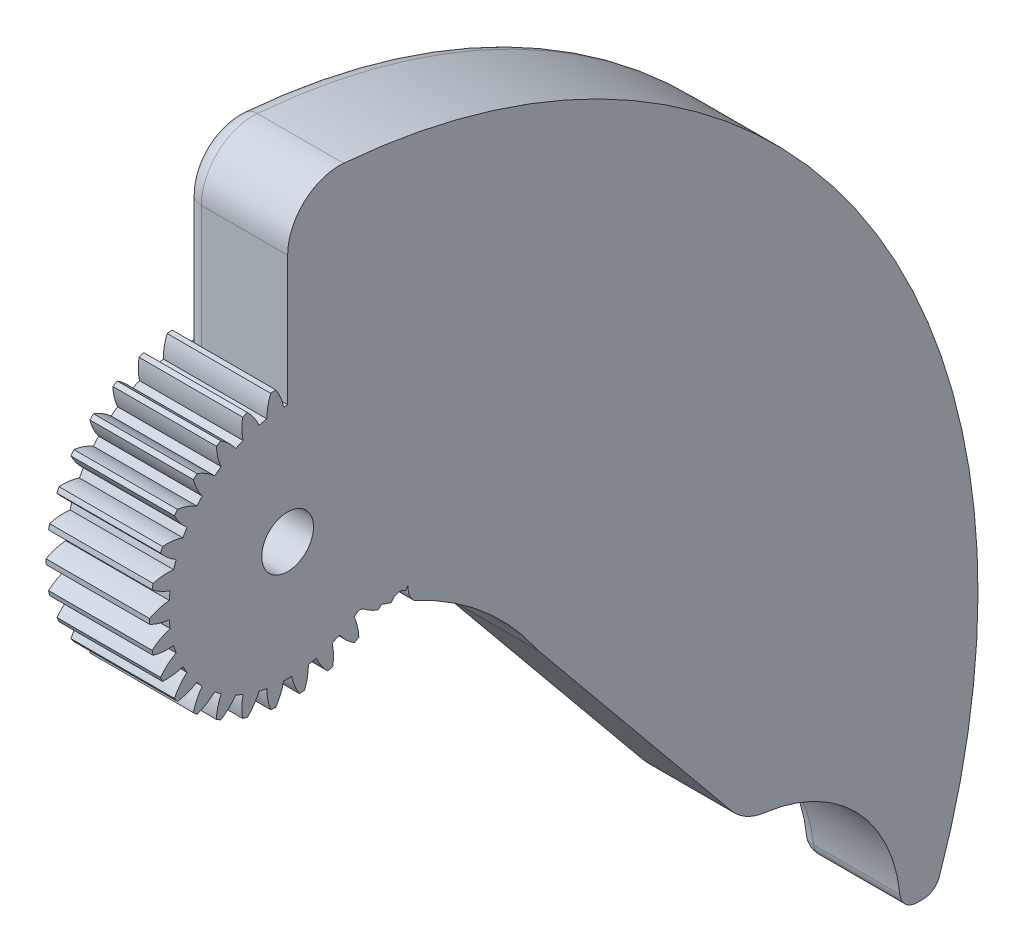
from build123d import *

# Parameters (mm, degrees)
SPUR_GEAR_GB_BORE_OUTLINE_R = 1
SPUR_GEAR_GB_BORE_DEPTH     = 6
EXTRUDE_START               = -6
SKETCH_3_R                  = 1
EXTRUDE_1_DEPTH             = 6
FILLET_2_R                  = 1
FILLET_4_R                  = 3
EXTRUDE_2_DEPTH             = 1
EXTRUDE_2_DEPTH_BACK        = 7
SKETCH_4_R                  = 1.5
FILLET_12_R                 = 3
FILLET_13_R                 = 3
CUT_EXTRUDE_4_DEPTH         = 2
FILLET_15_R                 = 1
CUT_EXTRUDE_5_DEPTH         = 57.089597141
CUT_EXTRUDE_5_DEPTH_BACK    = 57.089597141
SKETCH_9_W                  = 8
SKETCH_9_H                  = 20.416318458
SKETCH_9_H_2                = 38.197882951
CUT_EXTRUDE_7_DEPTH         = 10
CUT_EXTRUDE_7_DEPTH_BACK    = 10
SKETCH_10_R                 = 1.5


# Read off the part's stored shape, not the designer's step: <spur gear_gb>-<Bore>
with BuildPart() as part:
    # <spur gear_gb>-<Bore> outline → <spur gear_gb>-<Bore> (new body)
    with BuildSketch(Plane.YZ):
        with BuildLine():
            ThreePointArc((0.146326846, 7.998661666), (0, 8), (-0.146326846, 7.998661666))
            ThreePointArc((-0.146326846, 7.998661666), (-0.373564224, 7.444765892), (-0.486289788, 6.856777541))
            ThreePointArc((-0.486289788, 6.856777541), (-0.718528657, 6.836343509), (-0.949941023, 6.808045832))
            ThreePointArc((-0.949941023, 6.808045832), (-1.182452915, 7.359748265), (-1.519886018, 7.85429478))
            ThreePointArc((-1.519886018, 7.85429478), (-1.663293526, 7.825180806), (-1.806144524, 7.793448656))
            ThreePointArc((-1.806144524, 7.793448656), (-1.913254814, 7.204411526), (-1.901267401, 6.605835168))
            ThreePointArc((-1.901267401, 6.605835168), (-2.124182819, 6.537562493), (-2.344654853, 6.461769852))
            ThreePointArc((-2.344654853, 6.461769852), (-2.686791187, 6.953074323), (-3.11967257, 7.366657523))
            ThreePointArc((-3.11967257, 7.366657523), (-3.253893145, 7.308363661), (-3.387025021, 7.247624543))
            ThreePointArc((-3.387025021, 7.247624543), (-3.369326988, 6.649189806), (-3.233150506, 6.066186101))
            ThreePointArc((-3.233150506, 6.066186101), (-3.437, 5.953058626), (-3.636896014, 5.833083523))
            ThreePointArc((-3.636896014, 5.833083523), (-4.073703792, 6.242517668), (-4.583114461, 6.557061982))
            ThreePointArc((-4.583114461, 6.557061982), (-4.702282019, 6.472135955), (-4.819876271, 6.385044458))
            ThreePointArc((-4.819876271, 6.385044458), (-4.678143404, 5.803366584), (-4.423729419, 5.261415592))
            ThreePointArc((-4.423729419, 5.261415592), (-4.599603788, 5.10837753), (-4.770187368, 4.949463453))
            ThreePointArc((-4.770187368, 4.949463453), (-5.282575994, 5.259133036), (-5.846252257, 5.460891369))
            ThreePointArc((-5.846252257, 5.460891369), (-5.945158604, 5.353044851), (-6.042075799, 5.243407293))
            ThreePointArc((-6.042075799, 5.243407293), (-5.782502506, 4.703908396), (-5.420970129, 4.226695974))
            ThreePointArc((-5.420970129, 4.226695974), (-5.561182819, 4.040435824), (-5.694998644, 3.84952808))
            ThreePointArc((-5.694998644, 3.84952808), (-6.260574276, 4.045899054), (-6.853880777, 4.126053599))
            ThreePointArc((-6.853880777, 4.126053599), (-6.92820323, 4), (-7.000207622, 3.872608067))
            ThreePointArc((-7.000207622, 3.872608067), (-6.6341385, 3.398866838), (-6.181288432, 3.007249461))
            ThreePointArc((-6.181288432, 3.007249461), (-6.279711476, 2.795907685), (-6.370911152, 2.581349858))
            ThreePointArc((-6.370911152, 2.581349858), (-6.96495542, 2.65583987), (-7.561961817, 2.610887487))
            ThreePointArc((-7.561961817, 2.610887487), (-7.60845213, 2.472135955), (-7.652396782, 2.332557287))
            ThreePointArc((-7.652396782, 2.332557287), (-7.195830808, 1.94527849), (-6.671454769, 1.656371715))
            ThreePointArc((-6.671454769, 1.656371715), (-6.723786607, 1.429184963), (-6.768384272, 1.200354261))
            ThreePointArc((-6.768384272, 1.200354261), (-7.364934592, 1.149707739), (-7.939548841, 0.981613064))
            ThreePointArc((-7.939548841, 0.981613064), (-7.956175163, 0.836227706), (-7.970139481, 0.69056256))
            ThreePointArc((-7.970139481, 0.69056256), (-7.44303078, 0.406672138), (-6.87004652, 0.233102578))
            ThreePointArc((-6.87004652, 0.233102578), (-6.874, 0), (-6.87004652, -0.233102578))
            ThreePointArc((-6.87004652, -0.233102578), (-7.44303078, -0.406672138), (-7.970139481, -0.69056256))
            ThreePointArc((-7.970139481, -0.69056256), (-7.956175163, -0.836227706), (-7.939548841, -0.981613064))
            ThreePointArc((-7.939548841, -0.981613064), (-7.364934592, -1.149707739), (-6.768384272, -1.200354261))
            ThreePointArc((-6.768384272, -1.200354261), (-6.723786607, -1.429184963), (-6.671454769, -1.656371715))
            ThreePointArc((-6.671454769, -1.656371715), (-7.195830808, -1.94527849), (-7.652396782, -2.332557287))
            ThreePointArc((-7.652396782, -2.332557287), (-7.60845213, -2.472135955), (-7.561961817, -2.610887487))
            ThreePointArc((-7.561961817, -2.610887487), (-6.96495542, -2.65583987), (-6.370911152, -2.581349858))
            ThreePointArc((-6.370911152, -2.581349858), (-6.279711476, -2.795907685), (-6.181288432, -3.007249461))
            ThreePointArc((-6.181288432, -3.007249461), (-6.6341385, -3.398866838), (-7.000207622, -3.872608067))
            ThreePointArc((-7.000207622, -3.872608067), (-6.92820323, -4), (-6.853880777, -4.126053599))
            ThreePointArc((-6.853880777, -4.126053599), (-6.260574276, -4.045899054), (-5.694998644, -3.84952808))
            ThreePointArc((-5.694998644, -3.84952808), (-5.561182819, -4.040435824), (-5.420970129, -4.226695974))
            ThreePointArc((-5.420970129, -4.226695974), (-5.782502506, -4.703908396), (-6.042075799, -5.243407293))
            ThreePointArc((-6.042075799, -5.243407293), (-5.945158604, -5.353044851), (-5.846252257, -5.460891369))
            ThreePointArc((-5.846252257, -5.460891369), (-5.282575994, -5.259133036), (-4.770187368, -4.949463453))
            ThreePointArc((-4.770187368, -4.949463453), (-4.599603788, -5.10837753), (-4.423729419, -5.261415592))
            ThreePointArc((-4.423729419, -5.261415592), (-4.678143404, -5.803366584), (-4.819876271, -6.385044458))
            ThreePointArc((-4.819876271, -6.385044458), (-4.702282019, -6.472135955), (-4.583114461, -6.557061982))
            ThreePointArc((-4.583114461, -6.557061982), (-4.073703792, -6.242517668), (-3.636896014, -5.833083523))
            ThreePointArc((-3.636896014, -5.833083523), (-3.437, -5.953058626), (-3.233150506, -6.066186101))
            ThreePointArc((-3.233150506, -6.066186101), (-3.369326988, -6.649189806), (-3.387025021, -7.247624543))
            ThreePointArc((-3.387025021, -7.247624543), (-3.253893145, -7.308363661), (-3.11967257, -7.366657523))
            ThreePointArc((-3.11967257, -7.366657523), (-2.686791187, -6.953074323), (-2.344654853, -6.461769852))
            ThreePointArc((-2.344654853, -6.461769852), (-2.124182819, -6.537562493), (-1.901267401, -6.605835168))
            ThreePointArc((-1.901267401, -6.605835168), (-1.913254814, -7.204411526), (-1.806144524, -7.793448656))
            ThreePointArc((-1.806144524, -7.793448656), (-1.663293526, -7.825180806), (-1.519886018, -7.85429478))
            ThreePointArc((-1.519886018, -7.85429478), (-1.182452915, -7.359748265), (-0.949941023, -6.808045832))
            ThreePointArc((-0.949941023, -6.808045832), (-0.718528657, -6.836343509), (-0.486289788, -6.856777541))
            ThreePointArc((-0.486289788, -6.856777541), (-0.373564224, -7.444765892), (-0.146326846, -7.998661666))
            ThreePointArc((-0.146326846, -7.998661666), (0, -8), (0.146326846, -7.998661666))
            ThreePointArc((0.146326846, -7.998661666), (0.373564224, -7.444765892), (0.486289788, -6.856777541))
            ThreePointArc((0.486289788, -6.856777541), (0.718528657, -6.836343509), (0.949941023, -6.808045832))
            ThreePointArc((0.949941023, -6.808045832), (1.182452915, -7.359748265), (1.519886018, -7.85429478))
            ThreePointArc((1.519886018, -7.85429478), (1.663293526, -7.825180806), (1.806144524, -7.793448656))
            ThreePointArc((1.806144524, -7.793448656), (1.913254814, -7.204411526), (1.901267401, -6.605835168))
            ThreePointArc((1.901267401, -6.605835168), (2.124182819, -6.537562493), (2.344654853, -6.461769852))
            ThreePointArc((2.344654853, -6.461769852), (2.686791187, -6.953074323), (3.11967257, -7.366657523))
            ThreePointArc((3.11967257, -7.366657523), (3.253893145, -7.308363661), (3.387025021, -7.247624543))
            ThreePointArc((3.387025021, -7.247624543), (3.369326988, -6.649189806), (3.233150506, -6.066186101))
            ThreePointArc((3.233150506, -6.066186101), (3.437, -5.953058626), (3.636896014, -5.833083523))
            ThreePointArc((3.636896014, -5.833083523), (4.073703792, -6.242517668), (4.583114461, -6.557061982))
            ThreePointArc((4.583114461, -6.557061982), (4.702282019, -6.472135955), (4.819876271, -6.385044458))
            ThreePointArc((4.819876271, -6.385044458), (4.678143404, -5.803366584), (4.423729419, -5.261415592))
            ThreePointArc((4.423729419, -5.261415592), (4.599603788, -5.10837753), (4.770187368, -4.949463453))
            ThreePointArc((4.770187368, -4.949463453), (5.282575994, -5.259133036), (5.846252257, -5.460891369))
            ThreePointArc((5.846252257, -5.460891369), (5.945158604, -5.353044851), (6.042075799, -5.243407293))
            ThreePointArc((6.042075799, -5.243407293), (5.782502506, -4.703908396), (5.420970129, -4.226695974))
            ThreePointArc((5.420970129, -4.226695974), (5.561182819, -4.040435824), (5.694998644, -3.84952808))
            ThreePointArc((5.694998644, -3.84952808), (6.260574276, -4.045899054), (6.853880777, -4.126053599))
            ThreePointArc((6.853880777, -4.126053599), (6.92820323, -4), (7.000207622, -3.872608067))
            ThreePointArc((7.000207622, -3.872608067), (6.6341385, -3.398866838), (6.181288432, -3.007249461))
            ThreePointArc((6.181288432, -3.007249461), (6.279711476, -2.795907685), (6.370911152, -2.581349858))
            ThreePointArc((6.370911152, -2.581349858), (6.96495542, -2.65583987), (7.561961817, -2.610887487))
            ThreePointArc((7.561961817, -2.610887487), (7.60845213, -2.472135955), (7.652396782, -2.332557287))
            ThreePointArc((7.652396782, -2.332557287), (7.195830808, -1.94527849), (6.671454769, -1.656371715))
            ThreePointArc((6.671454769, -1.656371715), (6.723786607, -1.429184963), (6.768384272, -1.200354261))
            ThreePointArc((6.768384272, -1.200354261), (7.364934592, -1.149707739), (7.939548841, -0.981613064))
            ThreePointArc((7.939548841, -0.981613064), (7.956175163, -0.836227706), (7.970139481, -0.69056256))
            ThreePointArc((7.970139481, -0.69056256), (7.44303078, -0.406672138), (6.87004652, -0.233102578))
            ThreePointArc((6.87004652, -0.233102578), (6.874, 0), (6.87004652, 0.233102578))
            ThreePointArc((6.87004652, 0.233102578), (7.44303078, 0.406672138), (7.970139481, 0.69056256))
            ThreePointArc((7.970139481, 0.69056256), (7.956175163, 0.836227706), (7.939548841, 0.981613064))
            ThreePointArc((7.939548841, 0.981613064), (7.364934592, 1.149707739), (6.768384272, 1.200354261))
            ThreePointArc((6.768384272, 1.200354261), (6.723786607, 1.429184963), (6.671454769, 1.656371715))
            ThreePointArc((6.671454769, 1.656371715), (7.195830808, 1.94527849), (7.652396782, 2.332557287))
            ThreePointArc((7.652396782, 2.332557287), (7.60845213, 2.472135955), (7.561961817, 2.610887487))
            ThreePointArc((7.561961817, 2.610887487), (6.96495542, 2.65583987), (6.370911152, 2.581349858))
            ThreePointArc((6.370911152, 2.581349858), (6.279711476, 2.795907685), (6.181288432, 3.007249461))
            ThreePointArc((6.181288432, 3.007249461), (6.6341385, 3.398866838), (7.000207622, 3.872608067))
            ThreePointArc((7.000207622, 3.872608067), (6.92820323, 4), (6.853880777, 4.126053599))
            ThreePointArc((6.853880777, 4.126053599), (6.260574276, 4.045899054), (5.694998644, 3.84952808))
            ThreePointArc((5.694998644, 3.84952808), (5.561182819, 4.040435824), (5.420970129, 4.226695974))
            ThreePointArc((5.420970129, 4.226695974), (5.782502506, 4.703908396), (6.042075799, 5.243407293))
            ThreePointArc((6.042075799, 5.243407293), (5.945158604, 5.353044851), (5.846252257, 5.460891369))
            ThreePointArc((5.846252257, 5.460891369), (5.282575994, 5.259133036), (4.770187368, 4.949463453))
            ThreePointArc((4.770187368, 4.949463453), (4.599603788, 5.10837753), (4.423729419, 5.261415592))
            ThreePointArc((4.423729419, 5.261415592), (4.678143404, 5.803366584), (4.819876271, 6.385044458))
            ThreePointArc((4.819876271, 6.385044458), (4.702282019, 6.472135955), (4.583114461, 6.557061982))
            ThreePointArc((4.583114461, 6.557061982), (4.073703792, 6.242517668), (3.636896014, 5.833083523))
            ThreePointArc((3.636896014, 5.833083523), (3.437, 5.953058626), (3.233150506, 6.066186101))
            ThreePointArc((3.233150506, 6.066186101), (3.369326988, 6.649189806), (3.387025021, 7.247624543))
            ThreePointArc((3.387025021, 7.247624543), (3.253893145, 7.308363661), (3.11967257, 7.366657523))
            ThreePointArc((3.11967257, 7.366657523), (2.686791187, 6.953074323), (2.344654853, 6.461769852))
            ThreePointArc((2.344654853, 6.461769852), (2.124182819, 6.537562493), (1.901267401, 6.605835168))
            ThreePointArc((1.901267401, 6.605835168), (1.913254814, 7.204411526), (1.806144524, 7.793448656))
            ThreePointArc((1.806144524, 7.793448656), (1.663293526, 7.825180806), (1.519886018, 7.85429478))
            ThreePointArc((1.519886018, 7.85429478), (1.182452915, 7.359748265), (0.949941023, 6.808045832))
            ThreePointArc((0.949941023, 6.808045832), (0.718528657, 6.836343509), (0.486289788, 6.856777541))
            ThreePointArc((0.486289788, 6.856777541), (0.373564224, 7.444765892), (0.146326846, 7.998661666))
        make_face()
        Circle(SPUR_GEAR_GB_BORE_OUTLINE_R, mode=Mode.SUBTRACT)
    extrude(amount=SPUR_GEAR_GB_BORE_DEPTH)

    # 草图3 → 凸台-拉伸1 (add)
    with BuildSketch(Plane(origin=(6, 0, 0), x_dir=(0, 0, -1), z_dir=(1, 0, 0)).offset(EXTRUDE_START)):
        Circle(SKETCH_3_R)
        with BuildLine():
            ThreePointArc((0, 6.874), (0.116568051, 6.873011559), (0.233102578, 6.87004652))
            ThreePointArc((0.233102578, 6.87004652), (0.406672138, 7.44303078), (0.69056256, 7.970139481))
            ThreePointArc((0.69056256, 7.970139481), (0.836227706, 7.956175163), (0.981613064, 7.939548841))
            ThreePointArc((0.981613064, 7.939548841), (1.149707739, 7.364934592), (1.200354261, 6.768384272))
            ThreePointArc((1.200354261, 6.768384272), (1.429184963, 6.723786607), (1.656371715, 6.671454769))
            ThreePointArc((1.656371715, 6.671454769), (1.94527849, 7.195830808), (2.332557287, 7.652396782))
            ThreePointArc((2.332557287, 7.652396782), (2.472135955, 7.60845213), (2.610887487, 7.561961817))
            ThreePointArc((2.610887487, 7.561961817), (2.65583987, 6.96495542), (2.581349858, 6.370911152))
            ThreePointArc((2.581349858, 6.370911152), (2.795907685, 6.279711476), (3.007249461, 6.181288432))
            ThreePointArc((3.007249461, 6.181288432), (3.398866838, 6.6341385), (3.872608067, 7.000207622))
            ThreePointArc((3.872608067, 7.000207622), (4, 6.92820323), (4.126053599, 6.853880777))
            ThreePointArc((4.126053599, 6.853880777), (4.045899054, 6.260574276), (3.84952808, 5.694998644))
            ThreePointArc((3.84952808, 5.694998644), (4.040435824, 5.561182819), (4.226695974, 5.420970129))
            ThreePointArc((4.226695974, 5.420970129), (4.703908396, 5.782502506), (5.243407293, 6.042075799))
            ThreePointArc((5.243407293, 6.042075799), (5.353044851, 5.945158604), (5.460891369, 5.846252257))
            ThreePointArc((5.460891369, 5.846252257), (5.259133036, 5.282575994), (4.949463453, 4.770187368))
            ThreePointArc((4.949463453, 4.770187368), (5.108377531, 4.599603788), (5.261415592, 4.423729419))
            ThreePointArc((5.261415592, 4.423729419), (5.803366584, 4.678143404), (6.385044458, 4.819876271))
            ThreePointArc((6.385044458, 4.819876271), (6.472135955, 4.702282019), (6.557061982, 4.583114461))
            ThreePointArc((6.557061982, 4.583114461), (6.242517668, 4.073703792), (5.833083523, 3.636896014))
            ThreePointArc((5.833083523, 3.636896014), (5.953058626, 3.437), (6.066186101, 3.233150506))
            ThreePointArc((6.066186101, 3.233150506), (6.649189806, 3.369326988), (7.247624543, 3.387025021))
            ThreePointArc((7.247624543, 3.387025021), (7.308363661, 3.253893145), (7.366657523, 3.11967257))
            ThreePointArc((7.366657523, 3.11967257), (6.953074323, 2.686791187), (6.461769852, 2.344654853))
            ThreePointArc((6.461769852, 2.344654853), (6.537562493, 2.12418282), (6.605835168, 1.901267401))
            ThreePointArc((6.605835168, 1.901267401), (7.204411526, 1.913254814), (7.793448656, 1.806144524))
            ThreePointArc((7.793448656, 1.806144524), (7.825180806, 1.663293526), (7.85429478, 1.519886018))
            ThreePointArc((7.85429478, 1.519886018), (7.359748265, 1.182452915), (6.808045832, 0.949941023))
            ThreePointArc((6.808045832, 0.949941023), (6.836343509, 0.718528657), (6.856777541, 0.486289788))
            ThreePointArc((6.856777541, 0.486289788), (7.444765892, 0.373564224), (7.998661666, 0.146326846))
            ThreePointArc((7.998661666, 0.146326846), (8, 0), (7.998661666, -0.146326846))
            ThreePointArc((7.998661666, -0.146326846), (7.444765892, -0.373564224), (6.856777541, -0.486289788))
            ThreePointArc((6.856777541, -0.486289788), (6.836343509, -0.718528657), (6.808045832, -0.949941023))
            ThreePointArc((6.808045832, -0.949941023), (7.359748265, -1.182452915), (7.85429478, -1.519886018))
            ThreePointArc((7.85429478, -1.519886018), (7.825180806, -1.663293526), (7.793448656, -1.806144524))
            ThreePointArc((7.793448656, -1.806144524), (7.204411526, -1.913254814), (6.605835168, -1.901267401))
            ThreePointArc((6.605835168, -1.901267401), (6.537562493, -2.12418282), (6.461769852, -2.344654853))
            ThreePointArc((6.461769852, -2.344654853), (6.953074323, -2.686791187), (7.366657523, -3.11967257))
            ThreePointArc((7.366657523, -3.11967257), (7.308363661, -3.253893145), (7.247624543, -3.387025021))
            ThreePointArc((7.247624543, -3.387025021), (6.649189806, -3.369326988), (6.066186101, -3.233150506))
            ThreePointArc((6.066186101, -3.233150506), (5.953058626, -3.437), (5.833083523, -3.636896014))
            ThreePointArc((5.833083523, -3.636896014), (6.242517668, -4.073703792), (6.557061982, -4.583114461))
            ThreePointArc((6.557061982, -4.583114461), (6.472135955, -4.702282019), (6.385044458, -4.819876271))
            ThreePointArc((6.385044458, -4.819876271), (5.803366584, -4.678143404), (5.261415592, -4.423729419))
            ThreePointArc((5.261415592, -4.423729419), (5.108377531, -4.599603788), (4.949463453, -4.770187368))
            ThreePointArc((4.949463453, -4.770187368), (5.259133036, -5.282575994), (5.460891369, -5.846252257))
            ThreePointArc((5.460891369, -5.846252257), (5.449932317, -5.856469733), (5.438954148, -5.866666667))
            ThreePointArc((5.438954148, -5.866666667), (5.727459414, -5.963790983), (6.014231603, -6.065919003))
            ThreePointArc((6.014231603, -6.065919003), (6.365660186, -5.757994622), (6.818051819, -5.874876117))
            ThreePointArc((6.818051819, -5.874876117), (6.900351293, -5.77798858), (6.981274071, -5.67994827))
            Line((6.981274071, -5.67994827), (6.981274071, -5.845324529))
            ThreePointArc((6.981274071, -5.845324529), (7.05251579, -6.216010455), (7.256090183, -6.533879777))
            Line((7.256090183, -6.533879777), (7.325551695, -6.607036388))
            ThreePointArc((7.325551695, -6.607036388), (11.315016389, -9.150078497), (14.477500555, -12.668826231))
            Line((14.477500555, -12.668826231), (26.521904807, -27.346153846))
            ThreePointArc((26.521904807, -27.346153846), (32.885865838, -29.982192815), (35.521904807, -36.346153846))
            Line((35.521904807, -36.346153846), (37.527110516, -36.346153846))
            ThreePointArc((37.527110516, -36.346153846), (32.816506166, 0.370874996), (0, 17.5))
            Line((0, 17.5), (0, 6.874))
        make_face()
        with BuildLine():
            ThreePointArc((4.226695974, -5.420970129), (4.178848498, -5.457939285), (4.130677684, -5.494486133))
            ThreePointArc((4.130677684, -5.494486133), (4.2582419, -5.525979383), (4.385566063, -5.558429521))
            ThreePointArc((4.385566063, -5.558429521), (4.304927405, -5.491090913), (4.226695974, -5.420970129))
        make_face()
    extrude(amount=EXTRUDE_1_DEPTH)

    # 圆角2
    fillet_2_edges = [part.edges().sort_by_distance(p)[0] for p in [
        (3, -36.346153846, -37.527110516),
        (3, -36.346153846, -35.521904807),
    ]]
    fillet(fillet_2_edges, radius=FILLET_2_R)

    # 圆角4
    fillet_4_edges = [part.edges().sort_by_distance(p)[0] for p in [
        (3, 17.5, 0),
    ]]
    fillet(fillet_4_edges, radius=FILLET_4_R)

    # 草图4 → 凸台-拉伸2 (add, two sides: drawn at the far end of the back side and taken through both)
    with BuildSketch(Plane(origin=(6, 0, 0), x_dir=(0, 0, -1), z_dir=(1, 0, 0)).offset(-EXTRUDE_2_DEPTH_BACK)):
        Circle(SKETCH_4_R)
    extrude(amount=EXTRUDE_2_DEPTH + EXTRUDE_2_DEPTH_BACK)

    # 圆角12
    fillet_12_edges = [part.edges().sort_by_distance(p)[0] for p in [
        (3, -27.346153846, -26.521904807),
    ]]
    fillet(fillet_12_edges, radius=FILLET_12_R)

    # 圆角13
    # the kernel refuses this fillet: 3 mm, written as the material it takes off along each edge
    with BuildSketch(Plane(origin=(-0.326683618, -12.668826231, -14.477500555), x_dir=(0, -0.7730354346519555, -0.6343628431524521), z_dir=(1, 0, 0))) as fillet_13_piece_1:
        with BuildLine():
            CenterArc((0.130673447, 3), FILLET_13_R, 265.201625675, 4.798374325)
            ThreePointArc((-0.120275261, 0.010514301), (-0.060128563, 0.005360874), (0, 0))
            Line((0, 0), (0.130673447, 0))
        make_face()
    extrude(amount=6.653367237, mode=Mode.SUBTRACT)

    # 草图8 → 切除-拉伸4 (cut)
    with BuildSketch(Plane(origin=(6, 0, 0), x_dir=(0, 0, -1), z_dir=(1, 0, 0))):
        with BuildLine():
            Line((2, 9.64604276), (2, 14.378177829))
            ThreePointArc((2, 14.378177829), (2.322165611, 15.113392451), (3.081081081, 15.374885338))
            ThreePointArc((3.081081081, 15.374885338), (30.622404445, 0.000407685), (37.065250477, -30.876586838))
            ThreePointArc((37.065250477, -30.876586838), (36.648392735, -31.261324427), (36.140347856, -31.008967949))
            ThreePointArc((36.140347856, -31.008967949), (32.68375662, -27.233987132), (27.893022457, -25.431941259))
            ThreePointArc((27.893022457, -25.431941259), (27.534481636, -25.315256804), (27.244634082, -25.074102958))
            Line((27.244634082, -25.074102958), (16.106465804, -11.50111575))
            Line((16.106465804, -11.50111575), (16.056110934, -11.434228374))
            ThreePointArc((16.056110934, -11.434228374), (12.755730443, -7.750717276), (8.634797868, -5.01599972))
            ThreePointArc((8.634797868, -5.01599972), (8.381262895, -4.723999257), (8.411826139, -4.338499399))
            ThreePointArc((8.411826139, -4.338499399), (8.640174856, 3.863777232), (2.374557752, 9.162034246))
            ThreePointArc((2.374557752, 9.162034246), (2.104575466, 9.340037143), (2, 9.64604276))
        make_face()
    extrude(amount=-CUT_EXTRUDE_4_DEPTH, mode=Mode.SUBTRACT)

    # 圆角15
    # the kernel refuses this fillet: 1 mm, written as the material it takes off along each edge
    with BuildSketch(Plane(origin=(6, -22.5, 0), x_dir=(0, 0.9585171915228717, -0.28503472341998315), z_dir=(0, 0.28503472341998315, 0.9585171915228717))) as fillet_15_piece_1_section:
        with BuildLine():
            CenterArc((17.5 + FILLET_15_R, FILLET_15_R), FILLET_15_R, 180, 90)
            Line((17.5 + FILLET_15_R, 0), (17.5, 0))
            Line((17.5, 0), (17.5, FILLET_15_R))
        make_face()
    fillet_15_piece_1 = revolve(axis=Axis((6, -22.5, 0), (-1, 0, 0)), revolution_arc=38.864706403, mode=Mode.PRIVATE)
    fillet_15_piece_1 = fillet_15_piece_1 - Plane(origin=(5.717207108, -1.313e-06, -1.172e-06), x_dir=(0, -0.7552594768548913, -0.6554259093298617), z_dir=(-1, 0, 0)) * Cylinder(7.99999824, 75, mode=Mode.PRIVATE)
    add(fillet_15_piece_1, mode=Mode.SUBTRACT)
    with BuildSketch(Plane(origin=(6, 14.378177829, 0), x_dir=(-1, 0, 0), z_dir=(0, -1, 0))) as fillet_15_piece_2_section:
        with BuildLine():
            CenterArc((FILLET_15_R, FILLET_15_R), FILLET_15_R, 180, 90)
            Line((0, FILLET_15_R), (0, 0))
            Line((0, 0), (FILLET_15_R, 0))
        make_face()
    fillet_15_piece_2 = extrude(amount=10.004177829, mode=Mode.PRIVATE)
    fillet_15_piece_2 = fillet_15_piece_2 - Plane(origin=(5.7737618, 1.47e-07, 0), x_dir=(0, 0.9994248646952593, -0.03391076272900277), z_dir=(-1, 0, 0)) * Cylinder(6.873999853, 25, mode=Mode.PRIVATE)
    add(fillet_15_piece_2, mode=Mode.SUBTRACT)
    with BuildSketch(Plane(origin=(6, -36.346153846, -36.471779178), x_dir=(-1, 0, 0), z_dir=(0, 0, -1))) as fillet_15_piece_3:
        with BuildLine():
            CenterArc((FILLET_15_R, FILLET_15_R), FILLET_15_R, 180, 90)
            Line((0, FILLET_15_R), (0, 0))
            Line((0, 0), (FILLET_15_R, 0))
        make_face()
    extrude(amount=0.351804724, mode=Mode.SUBTRACT)
    with BuildSketch(Plane(origin=(6, -36.346153846, -26.521904807), x_dir=(0, 0.9922011442520794, -0.12464705911037026), z_dir=(0, 0.12464705911037026, 0.9922011442520794))) as fillet_15_piece_4:
        with BuildLine():
            CenterArc((9 + FILLET_15_R, FILLET_15_R), FILLET_15_R, 180, 90)
            Line((9 + FILLET_15_R, 0), (9, 0))
            Line((9, 0), (9, FILLET_15_R))
        make_face()
    revolve(axis=Axis((6, -36.346153846, -26.521904807), (-1, 0, 0)), revolution_arc=77.100455169, mode=Mode.SUBTRACT)
    with BuildSketch(Plane(origin=(6, -22.5, 0), x_dir=(0, -0.32938856015777646, -0.9441944590163548), z_dir=(0, -0.9441944590163548, 0.32938856015777646))) as fillet_15_piece_5:
        with BuildLine():
            CenterArc((40 - FILLET_15_R, -FILLET_15_R), FILLET_15_R, 0, 90)
            Line((40 - FILLET_15_R, 0), (40, 0))
            Line((40, 0), (40, -FILLET_15_R))
        make_face()
    revolve(axis=Axis((6, -22.5, 0), (1, 0, 0)), revolution_arc=104.580958789, mode=Mode.SUBTRACT)
    with BuildSketch(Plane(origin=(6, 14.378177829, -3), x_dir=(0, 0.9967075088965284, -0.08108108108108128), z_dir=(0, -0.08108108108108128, -0.9967075088965284))) as fillet_15_piece_6:
        with BuildLine():
            CenterArc((3 - FILLET_15_R, -FILLET_15_R), FILLET_15_R, 0, 90)
            Line((3 - FILLET_15_R, 0), (3, 0))
            Line((3, 0), (3, -FILLET_15_R))
        make_face()
    revolve(axis=Axis((6, 14.378177829, -3), (1, 0, 0)), revolution_arc=94.650709005, mode=Mode.SUBTRACT)
    with BuildSketch(Plane(origin=(6, -12.769841436, -14.560394934), x_dir=(-1, 0, 0), z_dir=(0, -0.7730354346519522, -0.634362843152456))) as fillet_15_piece_7:
        with BuildLine():
            CenterArc((FILLET_15_R, FILLET_15_R), FILLET_15_R, 180, 90)
            Line((0, FILLET_15_R), (0, 0))
            Line((0, 0), (FILLET_15_R, 0))
        make_face()
    extrude(amount=17.558040163, mode=Mode.SUBTRACT)
    with BuildSketch(Plane(origin=(6, -24.439740115, -28.017669516), x_dir=(0, -0.9922011442520796, 0.12464705911036944), z_dir=(0, -0.12464705911036944, -0.9922011442520796))) as fillet_15_piece_8:
        with BuildLine():
            CenterArc((3 - FILLET_15_R, FILLET_15_R), FILLET_15_R, 270, 90)
            Line((3 - FILLET_15_R, 0), (3, 0))
            Line((3, 0), (3, FILLET_15_R))
        make_face()
    revolve(axis=Axis((6, -24.439740115, -28.017669516), (-1, 0, 0)), revolution_arc=43.466881907, mode=Mode.SUBTRACT)
    with BuildSketch(Plane(origin=(6, -10.866752906, -16.879501238), x_dir=(0, -0.6343628431521604, 0.7730354346521948), z_dir=(0, -0.7730354346521948, -0.6343628431521604))) as fillet_15_piece_9:
        with BuildLine():
            CenterArc((3 - FILLET_15_R, FILLET_15_R), FILLET_15_R, 270, 90)
            Line((3 - FILLET_15_R, 0), (3, 0))
            Line((3, 0), (3, FILLET_15_R))
        make_face()
    revolve(axis=Axis((6, -10.866752906, -16.879501238), (-1, 0, 0)), revolution_arc=4.798374325, mode=Mode.SUBTRACT)
    with BuildSketch(Plane(origin=(6, -35.346153846, -36.471779178), x_dir=(0, -0.09999999999999407, 0.9949874371066205), z_dir=(0, 0.9949874371066205, 0.09999999999999407))) as fillet_15_piece_10:
        with BuildLine():
            CenterArc((1 - FILLET_15_R, -FILLET_15_R), FILLET_15_R, 0, 90)
            Line((1 - FILLET_15_R, 0), (1, 0))
            Line((1, 0), (1, -FILLET_15_R))
        make_face()
    revolve(axis=Axis((6, -35.346153846, -36.471779178), (1, 0, 0)), revolution_arc=84.260829523, mode=Mode.SUBTRACT)
    with BuildSketch(Plane(origin=(6, -35.346153846, -36.823583902), x_dir=(0, -0.3293885601577881, -0.9441944590163507), z_dir=(0, 0.9441944590163507, -0.3293885601577881))) as fillet_15_piece_11:
        with BuildLine():
            CenterArc((1 - FILLET_15_R, FILLET_15_R), FILLET_15_R, 270, 90)
            Line((1 - FILLET_15_R, 0), (1, 0))
            Line((1, 0), (1, FILLET_15_R))
        make_face()
    revolve(axis=Axis((6, -35.346153846, -36.823583902), (-1, 0, 0)), revolution_arc=70.768332207, mode=Mode.SUBTRACT)

    # 镜向1: part across plane


with BuildPart() as part_1:
    add(part.part)
    add(part.part.mirror(Plane(origin=(7, 0, 0), x_dir=(0, 0, 1), z_dir=(1, 0, 0))))

    # 草图9 → 切除-拉伸5 (cut, two sides: drawn at the far end of the back side and taken through both)
    with BuildSketch(Plane.XY.offset(-CUT_EXTRUDE_5_DEPTH_BACK)):
        with Locations((3, 10.208159229)):
            Rectangle(SKETCH_9_W, SKETCH_9_H)
        with Locations((3, -19.098941476)):
            Rectangle(SKETCH_9_W, SKETCH_9_H_2)
    extrude(amount=CUT_EXTRUDE_5_DEPTH + CUT_EXTRUDE_5_DEPTH_BACK, mode=Mode.SUBTRACT)

    # 草图10 → 切除-拉伸7 (cut, two sides: drawn at the far end of the back side and taken through both)
    with BuildSketch(Plane.ZY.offset(-8).offset(-CUT_EXTRUDE_7_DEPTH_BACK)):
        with Locations(Location((0, 0, 0), (0, 0, 180))):
            Circle(SKETCH_10_R)
    extrude(amount=CUT_EXTRUDE_7_DEPTH + CUT_EXTRUDE_7_DEPTH_BACK, mode=Mode.SUBTRACT)


solid = part_1.part
